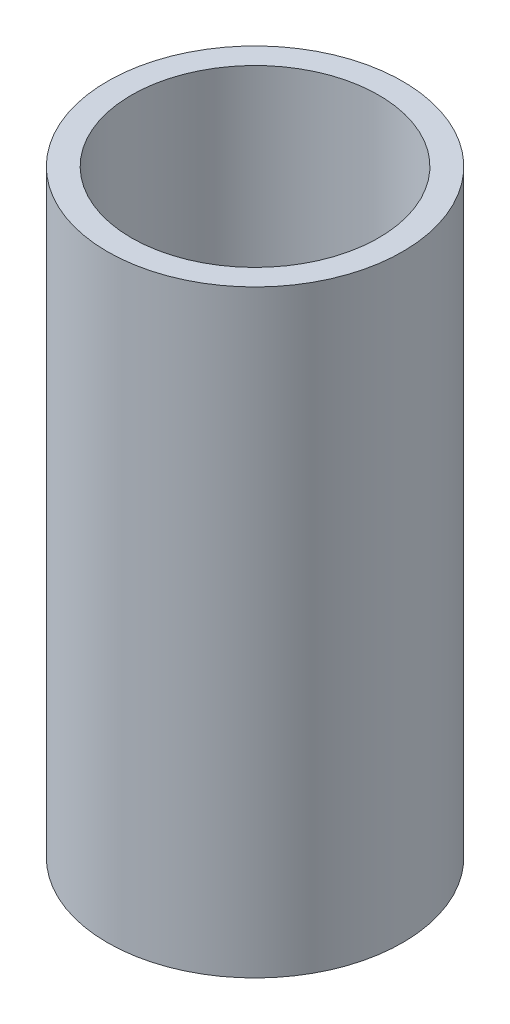
from build123d import *

# Parameters (mm, degrees)
SKETCH1_R           = 3.7
SKETCH1_R_2         = 3.1
BOSS_EXTRUDE1_DEPTH = 15


with BuildPart() as part:
    # Sketch1 → Boss-Extrude1 (new body)
    with BuildSketch(Plane(origin=(0, 0, 0), x_dir=(1, 0, 0), z_dir=(0, 1, 0))):
        Circle(SKETCH1_R)
        Circle(SKETCH1_R_2, mode=Mode.SUBTRACT)
    extrude(amount=BOSS_EXTRUDE1_DEPTH)


solid = part.part
